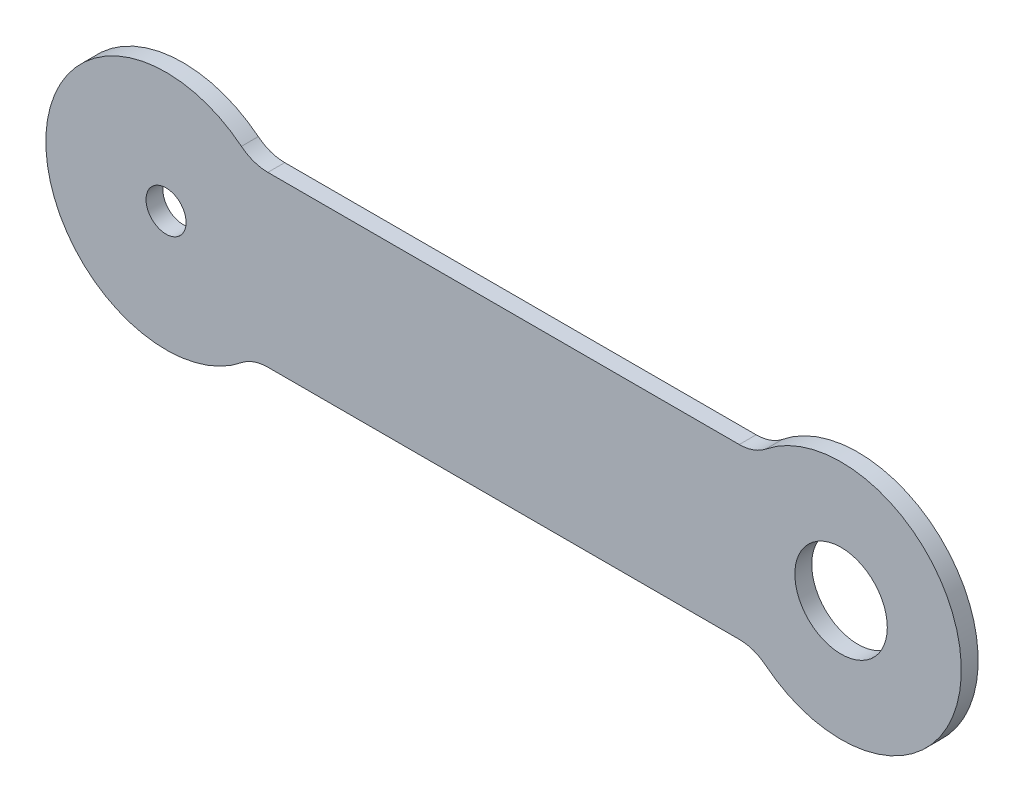
from build123d import *

# Parameters (mm, degrees)
EXTRUDE_1_DEPTH     = 4
SKETCH_12_R         = 4.75
SKETCH_12_R_2       = 10.958447214
CUT_EXTRUDE_1_DEPTH = 4
FILLET_1_R          = 10


with BuildPart() as part:
    # Sketch 1 → 凸台-拉伸1 (new body)
    with BuildSketch(Plane.XY):
        with BuildLine():
            ThreePointArc((-51.5, 0), (-53.628497347, 10.807120237), (-59.696059496, 20))
            ThreePointArc((-59.696059496, 20), (-108.5, 0), (-59.696059496, -20))
            ThreePointArc((-59.696059496, -20), (-53.628497347, -10.807120237), (-51.5, 0))
        make_face()
        with BuildLine():
            ThreePointArc((59.696059496, -20), (51.5, 0), (59.696059496, 20))
            Line((59.696059496, 20), (-59.696059496, 20))
            ThreePointArc((-59.696059496, 20), (-53.628497347, 10.807120237), (-51.5, 0))
            ThreePointArc((-51.5, 0), (-53.628497347, -10.807120237), (-59.696059496, -20))
            Line((-59.696059496, -20), (59.696059496, -20))
        make_face()
        with BuildLine():
            ThreePointArc((108.5, 0), (90.807120237, 26.371502653), (59.696059496, 20))
            ThreePointArc((59.696059496, 20), (51.5, 0), (59.696059496, -20))
            ThreePointArc((59.696059496, -20), (90.807120237, -26.371502653), (108.5, 0))
        make_face()
    extrude(amount=EXTRUDE_1_DEPTH)

    # 草图12 → 切除-拉伸1 (cut)
    with BuildSketch(Plane.XY.offset(4)):
        with Locations((-80, 0)):
            Circle(SKETCH_12_R)
        with Locations((80, 0)):
            Circle(SKETCH_12_R_2)
    extrude(amount=-CUT_EXTRUDE_1_DEPTH, mode=Mode.SUBTRACT)

    # 圆角1
    fillet_1_edges = [part.edges().sort_by_distance(p)[0] for p in [
        (-59.696059496, -20, 2),
        (59.696059496, -20, 2),
        (59.696059496, 20, 2),
        (-59.696059496, 20, 2),
    ]]
    fillet(fillet_1_edges, radius=FILLET_1_R)


solid = part.part
